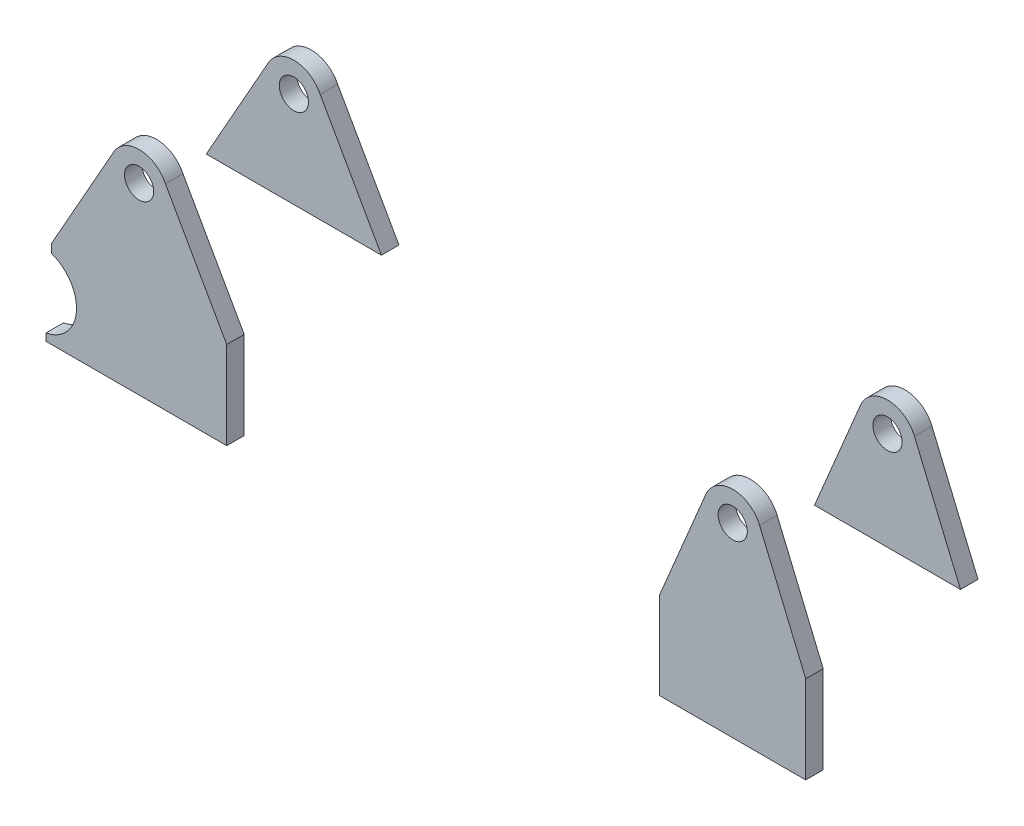
from build123d import *

# Parameters (mm, degrees)
BOSS_EXTRUDE1_DEPTH   = 6
BOSS_EXTRUDE1_2_DEPTH = 6
SKETCH2_R             = 5
BOSS_EXTRUDE2_DEPTH   = 6
BOSS_EXTRUDE2_2_DEPTH = 6


with BuildPart() as part:
    # Sketch1 → Boss-Extrude1 (new body)
    with BuildSketch(Plane.XY):
        with BuildLine():
            Line((-716.139861216, -515.57575128), (-737.428628659, -553.340939136))
            Line((-737.428628659, -553.340939136), (-737.428628659, -556.331866841))
            ThreePointArc((-737.428628659, -556.331866841), (-728.897629204, -569.31544762), (-739.314652141, -580.840939136))
            Line((-739.314652141, -580.840939136), (-739.314652141, -583.340939136))
            Line((-739.314652141, -583.340939136), (-677.428628659, -583.340939136))
            Line((-677.428628659, -583.340939136), (-677.428628659, -553.340939136))
            Line((-677.428628659, -553.340939136), (-698.394613553, -516.198439056))
            ThreePointArc((-698.394613553, -516.198439056), (-707.077940535, -510.492546569), (-716.139861216, -515.57575128))
        make_face()
        with BuildLine():
            add(Edge.make_bspline(
                [(-702.428724913, -520.517420238), (-702.366675575, -510.517612746), (-712.366483068, -510.455563408), (-712.428532405, -520.4553709), (-712.490581742, -530.455178393), (-702.49077425, -530.51722773), (-702.428724913, -520.517420238)],
                knots=[0, 0, 0, 0, 0.5, 0.5, 0.5, 1, 1, 1, 1], degree=3, weights=[1, 0.333333333, 0.333333333, 1, 0.333333333, 0.333333333, 1]))
        make_face(mode=Mode.SUBTRACT)
    extrude(amount=BOSS_EXTRUDE1_DEPTH)


with BuildPart() as body_2:
    # Sketch1 → Boss-Extrude1 2 (new body)
    with BuildSketch(Plane.XY):
        with BuildLine():
            Line((-513.347374444, -515.745502459), (-529.126603186, -553.340939136))
            Line((-529.126603186, -553.340939136), (-529.126603186, -583.340939136))
            Line((-529.126603186, -583.340939136), (-479.126603186, -583.340939136))
            Line((-479.126603186, -583.340939136), (-479.126603186, -553.340939136))
            Line((-479.126603186, -553.340939136), (-494.905831928, -515.745502459))
            ThreePointArc((-494.905831928, -515.745502459), (-504.126603186, -509.615564139), (-513.347374444, -515.745502459))
        make_face()
        with BuildLine():
            add(Edge.make_bspline(
                [(-499.12669944, -519.646588808), (-499.064650103, -509.646781316), (-509.064457595, -509.584731979), (-509.126506932, -519.584539471), (-509.188556269, -529.584346963), (-499.188748777, -529.6463963), (-499.12669944, -519.646588808)],
                knots=[0, 0, 0, 0, 0.5, 0.5, 0.5, 1, 1, 1, 1], degree=3, weights=[1, 0.333333333, 0.333333333, 1, 0.333333333, 0.333333333, 1]))
        make_face(mode=Mode.SUBTRACT)
    extrude(amount=BOSS_EXTRUDE1_2_DEPTH)


with BuildPart() as body_3:
    # Sketch2 → Boss-Extrude2 (new body)
    with BuildSketch(Plane(origin=(0, 0, -47), x_dir=(-1, 0, 0), z_dir=(0, 0, -1))):
        with BuildLine():
            Line((479.126603186, -553.340939136), (529.126603186, -553.340939136))
            Line((529.126603186, -553.340939136), (513.347374444, -515.745502459))
            ThreePointArc((513.347374444, -515.745502459), (504.126603186, -509.615564139), (494.905831928, -515.745502459))
            Line((494.905831928, -515.745502459), (479.126603186, -553.340939136))
        make_face()
        with Locations((504.126603186, -519.615564139)):
            Circle(SKETCH2_R, mode=Mode.SUBTRACT)
    extrude(amount=BOSS_EXTRUDE2_DEPTH)


with BuildPart() as body_4:
    # Sketch2 → Boss-Extrude2 2 (new body)
    with BuildSketch(Plane(origin=(0, 0, -47), x_dir=(-1, 0, 0), z_dir=(0, 0, -1))):
        with BuildLine():
            Line((677.428628659, -553.340939136), (737.428628659, -553.340939136))
            Line((737.428628659, -553.340939136), (716.139861216, -515.57575128))
            ThreePointArc((716.139861216, -515.57575128), (707.077940535, -510.492546569), (698.394613553, -516.198439056))
            Line((698.394613553, -516.198439056), (677.428628659, -553.340939136))
        make_face()
        with Locations((707.428628659, -520.486395569)):
            Circle(SKETCH2_R, mode=Mode.SUBTRACT)
    extrude(amount=BOSS_EXTRUDE2_2_DEPTH)


solid = Compound([part.part, body_2.part, body_3.part, body_4.part])
